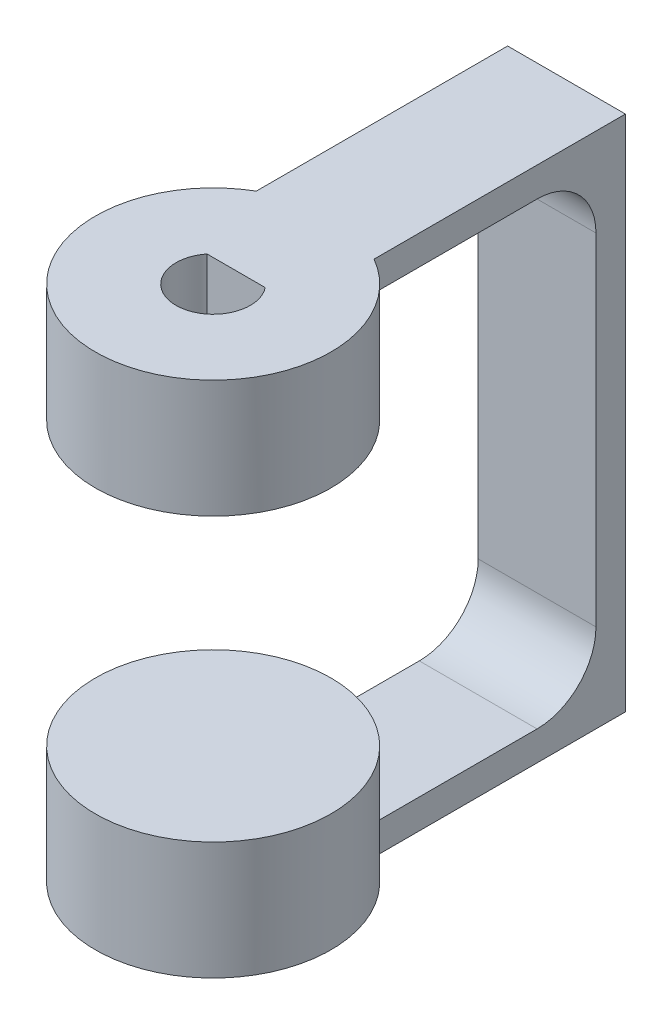
from build123d import *

# Parameters (mm, degrees)
SKETCH1_R               = 12.7
BOSS_EXTRUDE1_DEPTH     = 27.9146
CUT_EXTRUDE2_DEPTH      = 34.193446539
CUT_EXTRUDE2_DEPTH_BACK = 34.193446539
SKETCH4_W               = 25.4
SKETCH4_H               = 30.4292
BOSS_EXTRUDE2_DEPTH     = 6.35
CUT_EXTRUDE3_DEPTH      = 10.16
FILLET1_R               = 6.35


with BuildPart() as part:
    # Sketch1 → Boss-Extrude1 (new, symmetric)
    with BuildSketch(Plane(origin=(0, 0, 0), x_dir=(1, 0, 0), z_dir=(0, 1, 0))):
        Circle(SKETCH1_R)
    extrude(amount=BOSS_EXTRUDE1_DEPTH, both=True)

    # Sketch4 → Cut-Extrude2 (cut, two sides: drawn at the far end of the back side and taken through both)
    with BuildSketch(Plane.XY.offset(-CUT_EXTRUDE2_DEPTH_BACK)):
        Rectangle(SKETCH4_W, SKETCH4_H)
    extrude(amount=CUT_EXTRUDE2_DEPTH + CUT_EXTRUDE2_DEPTH_BACK, mode=Mode.SUBTRACT)


with BuildPart() as cut_extrude2_piece_1:
    # of the separate pieces the step leaves, piece 1, a body of its own (cut_extrude2_pieces)
    add(part.part.solids().sort_by_distance((12.7, -27.9146, 0))[0])



with BuildPart() as cut_extrude2_piece_2:
    # of the separate pieces the step leaves, piece 2, a body of its own (cut_extrude2_pieces)
    add(part.part.solids().sort_by_distance((12.7, 15.2146, 0))[0])


with BuildPart() as cut_extrude2_piece_1_1:
    add(cut_extrude2_piece_1.part)

    add(cut_extrude2_piece_2.part)  # Boss-Extrude2 merges Cut-Extrude2 piece 2
    # Sketch5 → Boss-Extrude2 (add, symmetric)
    with BuildSketch(Plane(origin=(0, 0, 0), x_dir=(0, 0, -1), z_dir=(1, 0, 0))):
        Polygon((0, 27.9146), (38.1, 27.9146), (38.1, -27.9146), (0, -27.9146), (0, -24.7396), (34.925, -24.7396), (34.925, 24.7396), (0, 24.7396), align=None)
    extrude(amount=BOSS_EXTRUDE2_DEPTH, both=True)

    # Sketch2 → Cut-Extrude3 (cut)
    with BuildSketch(Plane(origin=(0, 27.9146, 0), x_dir=(1, 0, 0), z_dir=(0, 1, 0))):
        with BuildLine():
            Line((-3.140775541, 2.477), (3.140775541, 2.477))
            ThreePointArc((3.140775541, 2.477), (0, -4), (-3.140775541, 2.477))
        make_face()
    cut_extrude3 = extrude(amount=-CUT_EXTRUDE3_DEPTH, mode=Mode.SUBTRACT)

    # Mirror1: Cut-Extrude3 across plane
    add(cut_extrude3.mirror(Plane.ZX), mode=Mode.SUBTRACT)

    # Fillet1
    fillet1_edges = [cut_extrude2_piece_1_1.edges().sort_by_distance(p)[0] for p in [
        (0, -24.7396, -34.925),
        (0, 24.7396, -34.925),
    ]]
    fillet(fillet1_edges, radius=FILLET1_R)


solid = cut_extrude2_piece_1_1.part
